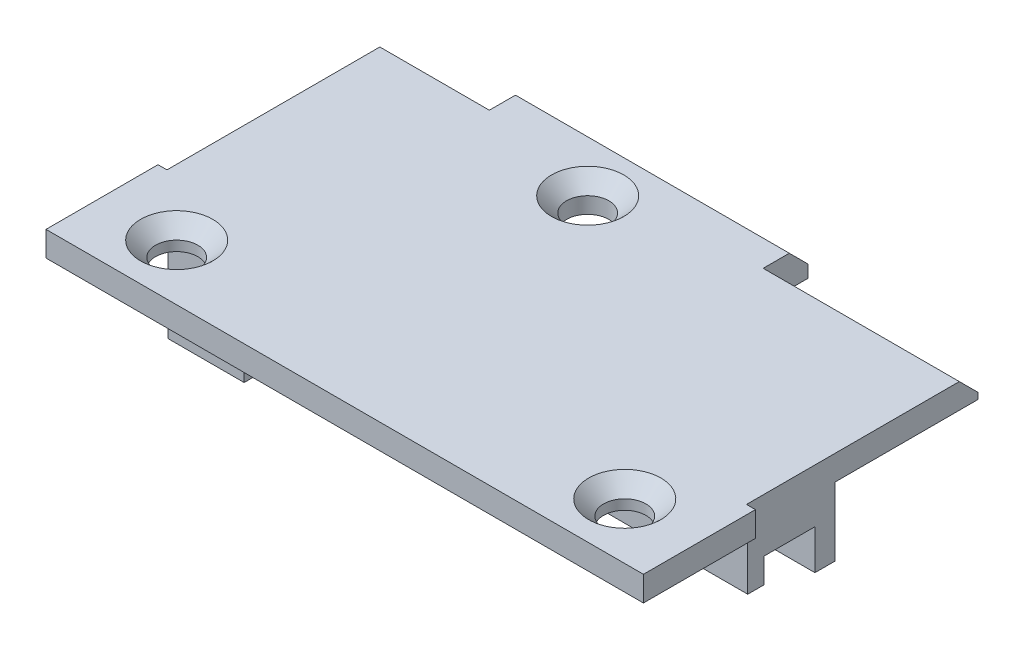
from build123d import *

# Parameters (mm, degrees)
SKETCH1_R           = 1.7
BOSS_EXTRUDE1_DEPTH = 2
CHAMFER1_SIZE       = 1.5
CHAMFER2_SIZE       = 1.2
SKETCH2_W           = 22
SKETCH2_H           = 1.7
BOSS_EXTRUDE2_DEPTH = 0.5
SKETCH3_W           = 14
SKETCH3_H           = 7
SKETCH3_R           = 1.7
BOSS_EXTRUDE3_DEPTH = 0.5
BOSS_EXTRUDE4_DEPTH = 5.5
FILLET1_R           = 0.5
SKETCH5_W           = 6.1
SKETCH5_H           = 5.4
BOSS_EXTRUDE5_DEPTH = 4.3
SKETCH6_W           = 40.46
SKETCH6_H           = 5.4
CUT_EXTRUDE1_DEPTH  = 1.2
CUT_EXTRUDE2_DEPTH  = 2
SKETCH8_W           = 14
SKETCH8_H           = 5
CUT_EXTRUDE3_DEPTH  = 1


with BuildPart() as part:
    # Sketch1 → Boss-Extrude1 (new body)
    with BuildSketch(Plane(origin=(0, 0, 0), x_dir=(1, 0, 0), z_dir=(0, 1, 0))):
        Polygon((0, 0), (0, 9), (0.72, 9), (0.72, 27.6), (9.52, 27.6), (9.52, 29.7), (31.52, 29.7), (31.52, 27.6), (47.28, 27.6), (47.28, 9), (48, 9), (48, 0), align=None)
        with Locations((19.42, 24.1)):
            Circle(SKETCH1_R, mode=Mode.SUBTRACT)
        with Locations((6, 4.5)):
            Circle(SKETCH1_R, mode=Mode.SUBTRACT)
        with Locations((42, 4.5)):
            Circle(SKETCH1_R, mode=Mode.SUBTRACT)
    extrude(amount=-BOSS_EXTRUDE1_DEPTH)

    # Chamfer1
    chamfer1_edges = [part.edges().sort_by_distance(p)[0] for p in [
        (5.12, 0, -27.6),
        (20.52, 0, -29.7),
        (39.4, 0, -27.6),
    ]]
    chamfer(chamfer1_edges, length=CHAMFER1_SIZE)

    # Chamfer2
    chamfer2_edges = [part.edges().sort_by_distance(p)[0] for p in [
        (4.3, 0, -4.5),
        (17.72, 0, -24.1),
        (40.3, 0, -4.5),
    ]]
    chamfer(chamfer2_edges, length=CHAMFER2_SIZE)

    # Sketch2 → Boss-Extrude2 (add)
    with BuildSketch(Plane.XZ.offset(2)):
        with Locations((20.52, -28.85)):
            Rectangle(SKETCH2_W, SKETCH2_H)
    extrude(amount=BOSS_EXTRUDE2_DEPTH)

    # Sketch3 → Boss-Extrude3 (add)
    with BuildSketch(Plane.XZ.offset(2)):
        with Locations((19.42, -24.5)):
            Rectangle(SKETCH3_W, SKETCH3_H)
        with Locations((19.42, -24.1)):
            Circle(SKETCH3_R, mode=Mode.SUBTRACT)
    extrude(amount=BOSS_EXTRUDE3_DEPTH)

    # Sketch4 → Boss-Extrude4 (add)
    with BuildSketch(Plane.XZ.offset(2)):
        Polygon((0.72, -9.1), (47.28, -9.1), (47.28, -16.1), (44.08, -16.1), (44.08, -16.3), (44.08, -18.2), (42.26, -18.2), (42.26, -16), (38.56, -16), (38.56, -18.2), (35.18, -18.2), (35.18, -16), (31.48, -16), (31.48, -18.2), (30.28, -18.2), (30.28, -14.4), (26.6, -14.4), (26.6, -13.4), (11.4, -13.4), (11.4, -18.2), (10.02, -18.2), (10.02, -16), (6.32, -16), (6.32, -18.2), (3.72, -18.2), (3.72, -19.4), (0.72, -19.4), align=None)
    extrude(amount=BOSS_EXTRUDE4_DEPTH)

    # Fillet1
    fillet1_edges = [part.edges().sort_by_distance(p)[0] for p in [
        (42.26, -4.75, -18.2),
        (42.26, -4.75, -16),
        (35.18, -4.75, -18.2),
        (35.18, -4.75, -16),
        (38.56, -4.75, -16),
        (38.56, -4.75, -18.2),
        (31.48, -4.75, -16),
        (31.48, -4.75, -18.2),
        (10.02, -4.75, -18.2),
        (10.02, -4.75, -16),
        (6.32, -4.75, -16),
        (6.32, -4.75, -18.2),
    ]]
    fillet(fillet1_edges, radius=FILLET1_R)

    # Sketch5 → Boss-Extrude5 (add)
    with BuildSketch(Plane.XZ.offset(7.5)):
        with Locations((3.77, -11.8)):
            Rectangle(SKETCH5_W, SKETCH5_H)
    extrude(amount=BOSS_EXTRUDE5_DEPTH)

    # Sketch6 → Cut-Extrude1 (cut)
    with BuildSketch(Plane.XZ.offset(7.5)):
        with Locations((27.05, -11.8)):
            Rectangle(SKETCH6_W, SKETCH6_H)
    extrude(amount=-CUT_EXTRUDE1_DEPTH, mode=Mode.SUBTRACT)

    # Sketch7 → Cut-Extrude2 (cut)
    with BuildSketch(Plane.XZ.offset(6.3)):
        with BuildLine():
            Line((11.4, -13.4), (11.4, -13.12))
            ThreePointArc((11.4, -13.12), (11.60493511, -12.509074208), (12.14, -12.15))
            Line((12.14, -12.15), (14.52, -11.489318534))
            ThreePointArc((14.52, -11.489318534), (19.044112004, -10.644197545), (23.64, -10.4))
            Line((23.64, -10.4), (47.28, -10.4))
            Line((47.28, -10.4), (47.28, -14.5))
            Line((47.28, -14.5), (26.6, -14.5))
            Line((26.6, -14.5), (26.6, -13.4))
            Line((26.6, -13.4), (11.4, -13.4))
        make_face()
    extrude(amount=-CUT_EXTRUDE2_DEPTH, mode=Mode.SUBTRACT)

    # Sketch8 → Cut-Extrude3 (cut)
    with BuildSketch(Plane.XZ.offset(2)):
        with Locations((19.42, -18.5)):
            Rectangle(SKETCH8_W, SKETCH8_H)
    extrude(amount=-CUT_EXTRUDE3_DEPTH, mode=Mode.SUBTRACT)


solid = part.part
